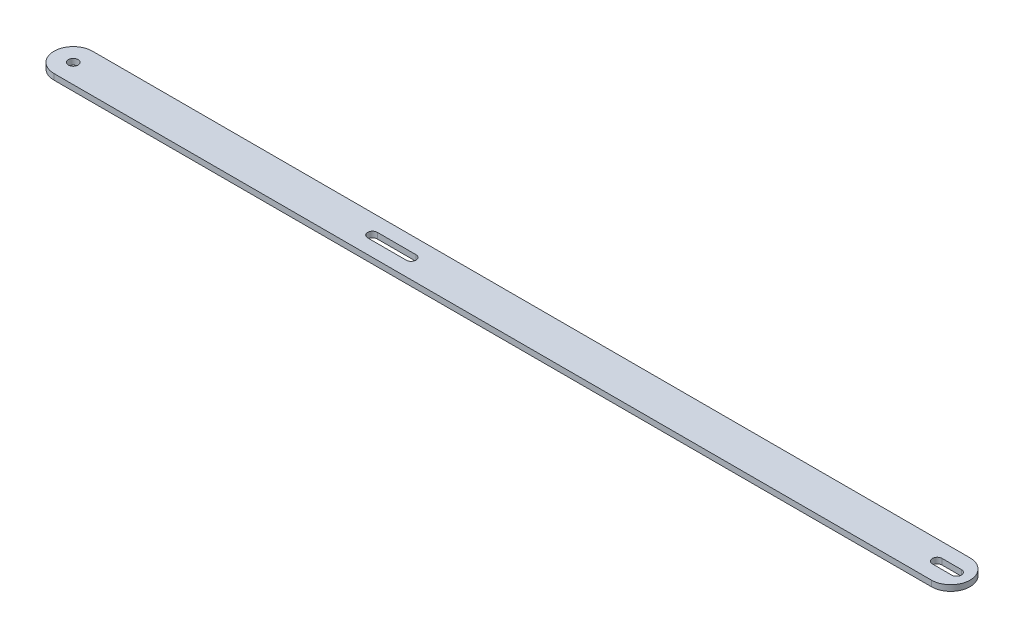
from build123d import *

# Parameters (mm, degrees)
SKETCH1_R           = 2.5
BOSS_EXTRUDE1_DEPTH = 3
CUT_EXTRUDE1_DEPTH  = 238.479604387


with BuildPart() as part:
    # Sketch1 → Boss-Extrude1 (new body)
    with BuildSketch(Plane(origin=(0, 0, 0), x_dir=(1, 0, 0), z_dir=(0, 1, 0))):
        with BuildLine():
            Line((-227.25, 10), (227.25, 10))
            ThreePointArc((227.25, 10), (237.25, 0), (227.25, -10))
            Line((227.25, -10), (-227.25, -10))
            ThreePointArc((-227.25, -10), (-237.25, 0), (-227.25, 10))
        make_face()
        with Locations((-227.25, 0)):
            Circle(SKETCH1_R, mode=Mode.SUBTRACT)
        with BuildLine():
            Line((230.25, -2.5), (220.25, -2.5))
            ThreePointArc((220.25, -2.5), (217.75, 0), (220.25, 2.5))
            Line((220.25, 2.5), (230.25, 2.5))
            ThreePointArc((230.25, 2.5), (232.75, 0), (230.25, -2.5))
        make_face(mode=Mode.SUBTRACT)
    extrude(amount=BOSS_EXTRUDE1_DEPTH)

    # Sketch2 → Cut-Extrude1 (cut, through all)
    with BuildSketch(Plane(origin=(0, 3, 0), x_dir=(1, 0, 0), z_dir=(0, 1, 0))):
        with BuildLine():
            Line((-72.25, 2.5), (-52.25, 2.5))
            ThreePointArc((-52.25, 2.5), (-49.75, 0), (-52.25, -2.5))
            Line((-52.25, -2.5), (-72.25, -2.5))
            ThreePointArc((-72.25, -2.5), (-74.75, 0), (-72.25, 2.5))
        make_face()
    extrude(amount=-CUT_EXTRUDE1_DEPTH, mode=Mode.SUBTRACT)


solid = part.part
